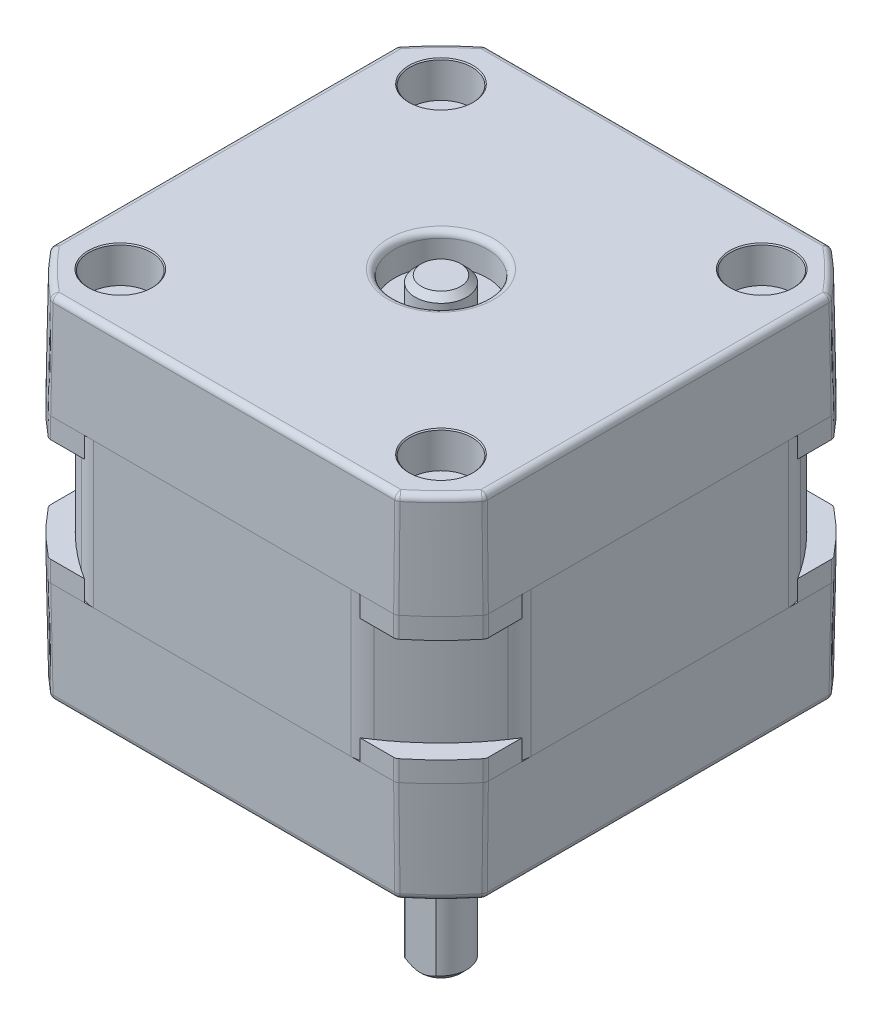
from build123d import *

# Parameters (mm, degrees)
SKETCH1_R                                   = 17.5
SKETCH1_R_2                                 = 1.75
CENTER_BODY_DEPTH                           = 14
TOP_CAP_BODY_DEPTH                          = 10
TOP_CAP_BODY_DRAFT                          = 1
TOP_CAP_BODY_OTHER_WAY_DEPTH                = 2
CUT_EXTRUDE1_START                          = -2
SKETCH4_R                                   = 25
CUT_EXTRUDE1_DEPTH                          = 2
FILLET3_R                                   = 3
CBORE_SLOT_FOR_M5_HEX_HEAD_BOLT1_AT_2_COUNT = 2
CBORE_SLOT_FOR_M5_HEX_HEAD_BOLT1_AT_2_PITCH = 31
CBORE_SLOT_FOR_M5_HEX_HEAD_BOLT1_AT_3_COUNT = 2
CBORE_SLOT_FOR_M5_HEX_HEAD_BOLT1_AT_3_PITCH = 43.840620434
CBORE_SLOT_FOR_M5_HEX_HEAD_BOLT1_AT_4_COUNT = 2
CBORE_SLOT_FOR_M5_HEX_HEAD_BOLT1_AT_4_PITCH = 31
SKETCH5_R                                   = 15.5
CUT_EXTRUDE2_DEPTH                          = 0.4
CUT_EXTRUDE2_DRAFT                          = -75
BOSS_EXTRUDE3_START                         = -0.4
SKETCH6_R                                   = 11
BOSS_EXTRUDE3_DEPTH                         = 2.4
M3_TAPPED_HOLE1_AT_2_COUNT                  = 2
M3_TAPPED_HOLE1_AT_2_PITCH                  = 31
M3_TAPPED_HOLE1_AT_3_COUNT                  = 2
M3_TAPPED_HOLE1_AT_3_PITCH                  = 43.840620434
M3_TAPPED_HOLE1_AT_4_COUNT                  = 2
M3_TAPPED_HOLE1_AT_4_PITCH                  = 31
SKETCH14_R                                  = 4.5
CUT_EXTRUDE3_DEPTH                          = 3
SKETCH15_R                                  = 2.5
BOSS_EXTRUDE4_DEPTH                         = 2.5
SKETCH16_R                                  = 4.5
CUT_EXTRUDE4_DEPTH                          = 3
SKETCH17_R                                  = 2.5
BOSS_EXTRUDE5_DEPTH                         = 25
CUT_EXTRUDE5_DEPTH                          = 20
SKETCH19_W                                  = 8
SKETCH19_H                                  = 7
CUT_EXTRUDE6_DEPTH                          = 4
FILLET1_R                                   = 0.6
FILLET2_R                                   = 0.6
CHAMFER1_SIZE                               = 0.6


with BuildPart() as part:
    # Sketch1 → center body (new body)
    with BuildSketch(Plane(origin=(0, 0, 0), x_dir=(1, 0, 0), z_dir=(0, 1, 0))):
        with BuildLine():
            Line((-21.15, 13.329572386), (-21.15, -13.329572386))
            ThreePointArc((-21.15, -13.329572386), (-17.67766953, -17.67766953), (-13.329572386, -21.15))
            Line((-13.329572386, -21.15), (13.329572386, -21.15))
            ThreePointArc((13.329572386, -21.15), (17.67766953, -17.67766953), (21.15, -13.329572386))
            Line((21.15, -13.329572386), (21.15, 13.329572386))
            ThreePointArc((21.15, 13.329572386), (17.67766953, 17.67766953), (13.329572386, 21.15))
            Line((13.329572386, 21.15), (-13.329572386, 21.15))
            ThreePointArc((-13.329572386, 21.15), (-17.67766953, 17.67766953), (-21.15, 13.329572386))
        make_face()
        with Locations(Location((0, 0, 0), (0, 0, 270))):
            Circle(SKETCH1_R, mode=Mode.SUBTRACT)
        with Locations(Location((-15.5, 15.5, 0), (0, 0, 270))):
            Circle(SKETCH1_R_2, mode=Mode.SUBTRACT)
        with Locations(Location((15.5, 15.5, 0), (0, 0, 90))):
            Circle(SKETCH1_R_2, mode=Mode.SUBTRACT)
        with Locations(Location((-15.5, -15.5, 0), (0, 0, 270))):
            Circle(SKETCH1_R_2, mode=Mode.SUBTRACT)
        with Locations(Location((15.5, -15.5, 0), (0, 0, 270))):
            Circle(SKETCH1_R_2, mode=Mode.SUBTRACT)
    extrude(amount=CENTER_BODY_DEPTH)

    # Fillet3
    fillet3_edges = [part.edges().sort_by_distance(p)[0] for p in [
        (21.15, 7, -13.329572386),
        (21.15, 7, 13.329572386),
        (13.329572386, 7, 21.15),
        (-13.329572386, 7, 21.15),
        (-21.15, 7, 13.329572386),
        (-21.15, 7, -13.329572386),
        (-13.329572386, 7, -21.15),
        (13.329572386, 7, -21.15),
    ]]
    fillet(fillet3_edges, radius=FILLET3_R)


with BuildPart() as body_2:
    # Sketch2 → top cap body (with draft: the straight prism first)
    with BuildSketch(Plane.XZ):
        with BuildLine():
            Line((-21.15, 16.783250579), (-21.15, -16.783250579))
            ThreePointArc((-21.15, -16.783250579), (-19.091883092, -19.091883092), (-16.783250579, -21.15))
            Line((-16.783250579, -21.15), (16.783250579, -21.15))
            ThreePointArc((16.783250579, -21.15), (19.091883092, -19.091883092), (21.15, -16.783250579))
            Line((21.15, -16.783250579), (21.15, 16.783250579))
            ThreePointArc((21.15, 16.783250579), (19.091883092, 19.091883092), (16.783250579, 21.15))
            Line((16.783250579, 21.15), (-16.783250579, 21.15))
            ThreePointArc((-16.783250579, 21.15), (-19.091883092, 19.091883092), (-21.15, 16.783250579))
        make_face()
    extrude(amount=TOP_CAP_BODY_DEPTH)
    # top cap body: the draft: its side faces are tilted about the plane it starts from
    top_cap_body_sides = [body_2.faces().sort_by_distance(p)[0] for p in [
        (-19.091883092, -5, 19.091883092),
        (-21.15, -5, 0),
        (-19.091883092, -5, -19.091883092),
        (0, -5, -21.15),
        (19.091883092, -5, -19.091883092),
        (21.15, -5, 0),
        (19.091883092, -5, 19.091883092),
        (0, -5, 21.15),
    ]]
    draft(top_cap_body_sides, Plane.XZ, TOP_CAP_BODY_DRAFT)

    # Sketch2 → top cap body other way (add)
    with BuildSketch(Plane.XZ):
        with BuildLine():
            Line((-21.15, 16.783250579), (-21.15, -16.783250579))
            ThreePointArc((-21.15, -16.783250579), (-19.091883092, -19.091883092), (-16.783250579, -21.15))
            Line((-16.783250579, -21.15), (16.783250579, -21.15))
            ThreePointArc((16.783250579, -21.15), (19.091883092, -19.091883092), (21.15, -16.783250579))
            Line((21.15, -16.783250579), (21.15, 16.783250579))
            ThreePointArc((21.15, 16.783250579), (19.091883092, 19.091883092), (16.783250579, 21.15))
            Line((16.783250579, 21.15), (-16.783250579, 21.15))
            ThreePointArc((-16.783250579, 21.15), (-19.091883092, 19.091883092), (-21.15, 16.783250579))
        make_face()
    extrude(amount=-TOP_CAP_BODY_OTHER_WAY_DEPTH)

    # Sketch4 → Cut-Extrude1 (cut)
    with BuildSketch(Plane(origin=(0, 2, 0), x_dir=(1, 0, 0), z_dir=(0, 1, 0)).offset(CUT_EXTRUDE1_START)):
        Circle(SKETCH4_R)
    extrude(amount=CUT_EXTRUDE1_DEPTH, mode=Mode.SUBTRACT)


with BuildPart() as body_3:
    # bottom cap: mirrored copy
    add(body_2.part.mirror(Plane(origin=(0, 7, 0), x_dir=(0, 0, 1), z_dir=(0, -1, 0))))

    # Sketch10 → CBORE SLOT for M5 Hex Head Bolt1 (revolve, cut)
    with BuildSketch(Plane(origin=(-15.5, 24, -15.5), x_dir=(0, 0, 1), z_dir=(1, 0, 0))):
        Polygon((0, 0), (0, 12.96037699), (1.6, 11.999), (1.6, 3.5), (3, 3.5), (3, 0.1), (3.1, 0), align=None)
    cbore_slot_for_m5_hex_head_bolt1 = revolve(axis=Axis((-15.5, 30.35, -15.5), (0, -1, 0)), mode=Mode.SUBTRACT)

    # CBORE SLOT for M5 Hex Head Bolt1 at 2: CBORE SLOT for M5 Hex Head Bolt1 ×2
    with Locations(*[(i * CBORE_SLOT_FOR_M5_HEX_HEAD_BOLT1_AT_2_PITCH, 0, 0) for i in range(1, CBORE_SLOT_FOR_M5_HEX_HEAD_BOLT1_AT_2_COUNT)]):
        add(cbore_slot_for_m5_hex_head_bolt1, mode=Mode.SUBTRACT)

    # CBORE SLOT for M5 Hex Head Bolt1 at 3: CBORE SLOT for M5 Hex Head Bolt1 ×2
    with Locations(*[Vector(0.7071067811865476, 0, 0.7071067811865476) * (i * CBORE_SLOT_FOR_M5_HEX_HEAD_BOLT1_AT_3_PITCH) for i in range(1, CBORE_SLOT_FOR_M5_HEX_HEAD_BOLT1_AT_3_COUNT)]):
        add(cbore_slot_for_m5_hex_head_bolt1, mode=Mode.SUBTRACT)

    # CBORE SLOT for M5 Hex Head Bolt1 at 4: CBORE SLOT for M5 Hex Head Bolt1 ×2
    with Locations(*[(0, 0, i * CBORE_SLOT_FOR_M5_HEX_HEAD_BOLT1_AT_4_PITCH) for i in range(1, CBORE_SLOT_FOR_M5_HEX_HEAD_BOLT1_AT_4_COUNT)]):
        add(cbore_slot_for_m5_hex_head_bolt1, mode=Mode.SUBTRACT)

    # Sketch14 → Cut-Extrude3 (cut)
    with BuildSketch(Plane(origin=(0, 24, 0), x_dir=(1, 0, 0), z_dir=(0, 1, 0))):
        with Locations(Location((0, 0, 0), (0, 0, 270))):
            Circle(SKETCH14_R)
    extrude(amount=-CUT_EXTRUDE3_DEPTH, mode=Mode.SUBTRACT)

    # Sketch15 → Boss-Extrude4 (add)
    with BuildSketch(Plane(origin=(0, 21, 0), x_dir=(1, 0, 0), z_dir=(0, 1, 0))):
        with Locations(Location((0, 0, 0), (0, 0, 270))):
            Circle(SKETCH15_R)
    extrude(amount=BOSS_EXTRUDE4_DEPTH)


with BuildPart() as cut_extrude2_tool:
    # Sketch5 → Cut-Extrude2 (with draft: the straight prism first)
    with BuildSketch(Plane.XZ.offset(10)):
        Circle(SKETCH5_R)
    extrude(amount=-CUT_EXTRUDE2_DEPTH)
    # Cut-Extrude2: the draft: its side faces are tilted about the plane it starts from
    cut_extrude2_sides = [cut_extrude2_tool.faces().sort_by_distance(p)[0] for p in [
        (-15.5, -9.8, 0),
    ]]
    draft(cut_extrude2_sides, Plane.XZ.offset(10), CUT_EXTRUDE2_DRAFT)


with BuildPart() as body_2_1:
    add(body_2.part)

    # Cut-Extrude2: cut by cut_extrude2_tool
    add(cut_extrude2_tool.part, mode=Mode.SUBTRACT)

    # Sketch6 → Boss-Extrude3 (add)
    with BuildSketch(Plane.XZ.offset(10).offset(BOSS_EXTRUDE3_START)):
        with Locations(Location((0, 0, 0), (0, 0, 270))):
            Circle(SKETCH6_R)
    extrude(amount=BOSS_EXTRUDE3_DEPTH)

    # Sketch13 → M3 Tapped Hole1 (revolve, cut)
    with BuildSketch(Plane(origin=(15.5, -10, -15.5), x_dir=(0, 0, -1), z_dir=(1, 0, 0))):
        Polygon((0, 0), (0, 12.750075774), (1.25, 11.999), (1.25, 0.45), (1.7, 0), align=None)
    m3_tapped_hole1 = revolve(axis=Axis((15.5, -16.35, -15.5), (0, 1, 0)), mode=Mode.SUBTRACT)

    # M3 Tapped Hole1 at 2: M3 Tapped Hole1 ×2
    with Locations(*[(-i * M3_TAPPED_HOLE1_AT_2_PITCH, 0, 0) for i in range(1, M3_TAPPED_HOLE1_AT_2_COUNT)]):
        add(m3_tapped_hole1, mode=Mode.SUBTRACT)

    # M3 Tapped Hole1 at 3: M3 Tapped Hole1 ×2
    with Locations(*[Vector(-0.7071067811865476, 0, 0.7071067811865475) * (i * M3_TAPPED_HOLE1_AT_3_PITCH) for i in range(1, M3_TAPPED_HOLE1_AT_3_COUNT)]):
        add(m3_tapped_hole1, mode=Mode.SUBTRACT)

    # M3 Tapped Hole1 at 4: M3 Tapped Hole1 ×2
    with Locations(*[(0, 0, i * M3_TAPPED_HOLE1_AT_4_PITCH) for i in range(1, M3_TAPPED_HOLE1_AT_4_COUNT)]):
        add(m3_tapped_hole1, mode=Mode.SUBTRACT)

    # Sketch16 → Cut-Extrude4 (cut)
    with BuildSketch(Plane.XZ.offset(12)):
        with Locations(Location((0, 0, 0), (0, 0, 90))):
            Circle(SKETCH16_R)
    extrude(amount=-CUT_EXTRUDE4_DEPTH, mode=Mode.SUBTRACT)

    # Sketch17 → Boss-Extrude5 (add)
    with BuildSketch(Plane.XZ.offset(9)):
        with Locations(Location((0, 0, 0), (0, 0, 90))):
            Circle(SKETCH17_R)
    extrude(amount=BOSS_EXTRUDE5_DEPTH)

    # Sketch18 → Cut-Extrude5 (cut)
    with BuildSketch(Plane.XZ.offset(34)):
        with BuildLine():
            Line((-1.5, 2), (1.5, 2))
            ThreePointArc((1.5, 2), (0, 2.5), (-1.5, 2))
        make_face()
    extrude(amount=-CUT_EXTRUDE5_DEPTH, mode=Mode.SUBTRACT)

    # Fillet1
    fillet1_edges = [body_2_1.edges().sort_by_distance(p)[0] for p in [
        (0, -12, -4.5),
        (16.783250579, 1, -21.15),
        (-16.783250579, 1, -21.15),
        (-21.15, 1, -16.783250579),
        (-21.15, 1, 16.783250579),
        (-16.783250579, 1, 21.15),
        (16.783250579, 1, 21.15),
        (21.15, 1, 16.783250579),
        (21.15, 1, -16.783250579),
        (16.752802114, -5.000000169, -21.062724672),
        (21.062724672, -5.000000169, -16.752802114),
        (21.062724672, -5.000000169, 16.752802114),
        (16.752802114, -5.000000169, 21.062724672),
        (-16.752802114, -5.000000169, 21.062724672),
        (-21.062724672, -5.000000169, 16.752802114),
        (-21.062724672, -5.000000169, -16.752802114),
        (-16.752802114, -5.000000169, -21.062724672),
        (18.968457144, -10, -18.968457144),
        (20.975449351, -10, 0),
        (18.968457144, -10, 18.968457144),
        (0, -10, 20.975449351),
        (-18.968457144, -10, 18.968457144),
        (-20.975449351, -10, 0),
        (-18.968457144, -10, -18.968457144),
        (0, -10, -20.975449351),
        (0, -12, 11),
    ]]
    fillet(fillet1_edges, radius=FILLET1_R)

    # Chamfer2: read off the stored shape, not the designer's step
    # Chamfer2 outline → Chamfer2 (revolve, cut)
    with BuildSketch(Plane.XY):
        Polygon((2.5, -33.4), (1.9, -34), (2.5, -34), align=None)
    revolve(axis=Axis((0, 0, 0), (0, 1, 0)), mode=Mode.SUBTRACT)


with BuildPart() as cut_extrude6_tool:
    # Sketch19 → Cut-Extrude6 (new body)
    with BuildSketch(Plane(origin=(0, 0.373326388, -21.387854473), x_dir=(-1, 0, 0), z_dir=(0, 0.01745240643728355, -0.9998476951563913))):
        with Locations((0, 17.128749336)):
            Rectangle(SKETCH19_W, SKETCH19_H)
    extrude(amount=-CUT_EXTRUDE6_DEPTH)


with BuildPart() as part_1:
    add(part.part)

    # Cut-Extrude6: cut by cut_extrude6_tool
    add(cut_extrude6_tool.part, mode=Mode.SUBTRACT)


with BuildPart() as body_3_1:
    add(body_3.part)

    # Cut-Extrude6: cut by cut_extrude6_tool
    add(cut_extrude6_tool.part, mode=Mode.SUBTRACT)

    # Fillet2
    fillet2_edges = [body_3_1.edges().sort_by_distance(p)[0] for p in [
        (16.783250579, 13, -21.15),
        (-16.783250579, 13, -21.15),
        (-21.15, 13, -16.783250579),
        (-21.15, 13, 16.783250579),
        (-16.783250579, 13, 21.15),
        (16.783250579, 13, 21.15),
        (21.15, 13, 16.783250579),
        (0, 24, -4.5),
        (21.15, 13, -16.783250579),
        (4, 14, -19.149695344),
        (-4, 14, -19.149695344),
        (16.752802114, 19.000000169, -21.062724672),
        (21.062724672, 19.000000169, -16.752802114),
        (21.062724672, 19.000000169, 16.752802114),
        (16.752802114, 19.000000169, 21.062724672),
        (-16.752802114, 19.000000169, 21.062724672),
        (-21.062724672, 19.000000169, 16.752802114),
        (-21.062724672, 19.000000169, -16.752802114),
        (-16.752802114, 19.000000169, -21.062724672),
        (18.968457144, 24, -18.968457144),
        (20.975449351, 24, 0),
        (18.968457144, 24, 18.968457144),
        (0, 24, 20.975449351),
        (-18.968457144, 24, 18.968457144),
        (-20.975449351, 24, 0),
        (-18.968457144, 24, -18.968457144),
        (0, 24, -20.975449351),
    ]]
    fillet(fillet2_edges, radius=FILLET2_R)

    # Chamfer1
    chamfer1_edges = [body_3_1.edges().sort_by_distance(p)[0] for p in [
        (0, 23.5, -2.5),
    ]]
    chamfer(chamfer1_edges, length=CHAMFER1_SIZE)


solid = Compound([body_2_1.part, part_1.part, body_3_1.part])
